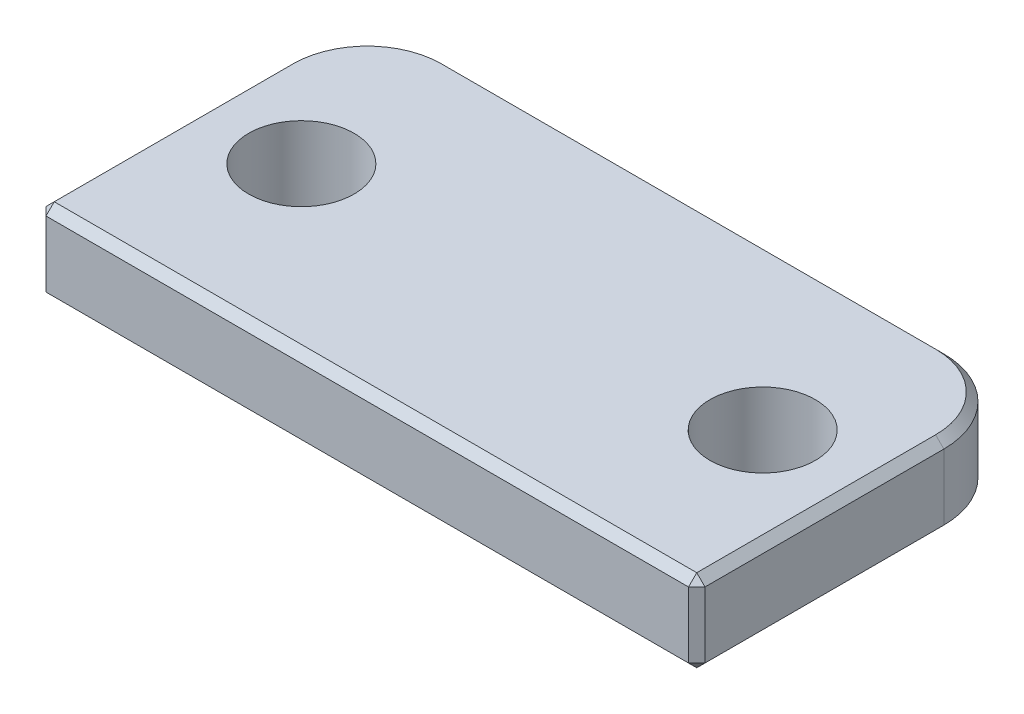
from build123d import *

# Parameters (mm, degrees)
SKETCH1_W            = 40
SKETCH1_H            = 20
BOSS_EXTRUDE1_DEPTH  = 5
M6_CLEARANCE_HOLE1_D = 6.4
FILLET1_R            = 5
CHAMFER1_SIZE        = 0.5


with BuildPart() as part:
    # Sketch1 → Boss-Extrude1 (new body)
    with BuildSketch(Plane(origin=(0, 0, 0), x_dir=(1, 0, 0), z_dir=(0, 1, 0))):
        Rectangle(SKETCH1_W, SKETCH1_H)
    extrude(amount=BOSS_EXTRUDE1_DEPTH)

    # M6 Clearance Hole1 (through all)
    with Locations(Plane(origin=(0, 5, 0), x_dir=(1, 0, 0), z_dir=(0, 1, 0))):
        with Locations((-14, 0), (14, 0)):
            Hole(M6_CLEARANCE_HOLE1_D / 2)

    # Fillet1
    fillet1_edges = [part.edges().sort_by_distance(p)[0] for p in [
        (-20, 2.5, -10),
        (20, 2.5, -10),
    ]]
    fillet(fillet1_edges, radius=FILLET1_R)

    # Chamfer1
    chamfer1_edges = [part.edges().sort_by_distance(p)[0] for p in [
        (0, 0, -10),
        (-20, 2.5, 10),
        (-20, 5, 2.5),
        (-20, 0, 2.5),
        (20, 0, 2.5),
        (0, 0, 10),
        (20, 2.5, 10),
        (0, 5, -10),
        (20, 5, 2.5),
        (0, 5, 10),
        (-18.535533906, 5, -8.535533906),
        (-18.535533906, 0, -8.535533906),
        (18.535533906, 0, -8.535533906),
        (18.535533906, 5, -8.535533906),
    ]]
    chamfer(chamfer1_edges, length=CHAMFER1_SIZE)


solid = part.part
